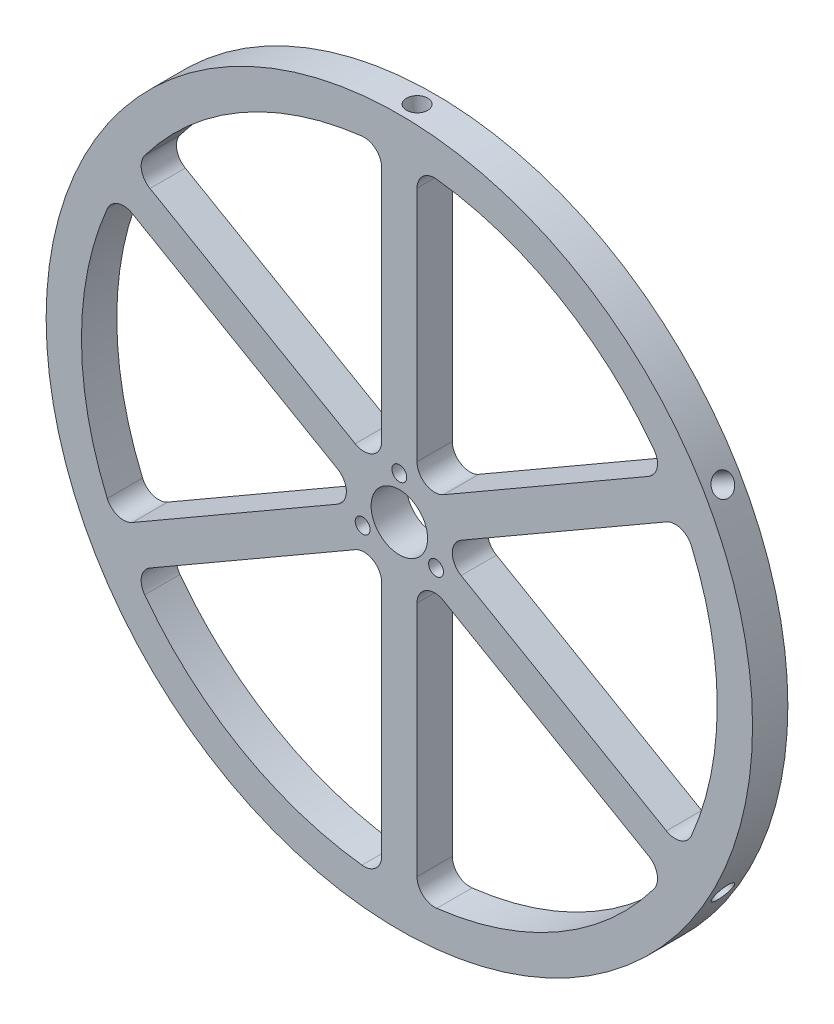
from build123d import *

# Parameters (mm, degrees)
ESQUISSE1_R                  = 100
BOSS_EXTRU_1_DEPTH           = 10
ENL_V_MAT_EXTRU_1_DEPTH      = 142.774468788
ENL_V_MAT_EXTRU_1_DEPTH_BACK = 142.774468788
CONG_1_R                     = 5
ENL_V_MAT_EXTRU_2_DEPTH      = 142.774468788
ENL_V_MAT_EXTRU_2_DEPTH_BACK = 142.774468788
ESQUISSE3_R                  = 8
ENL_V_MAT_EXTRU_3_DEPTH      = 142.774468788
ENL_V_MAT_EXTRU_3_DEPTH_BACK = 142.774468788
ESQUISSE4_R                  = 2.1
ENL_V_START                  = 100
ESQUISSE5_R                  = 3
ENL_V_MAT_EXTRU_4_DEPTH      = 10
R_P_TITION_CIRCULAIRE1_COUNT = 6


with BuildPart() as part:
    # Esquisse1 → Boss.-Extru.1 (new body)
    with BuildSketch(Plane.XY):
        Circle(ESQUISSE1_R)
    extrude(amount=BOSS_EXTRU_1_DEPTH)

    # Esquisse2 → Enlèv. mat.-Extru.1 (cut, two sides: drawn at the far end of the back side and taken through both)
    with BuildSketch(Plane.XY.offset(10).offset(-ENL_V_MAT_EXTRU_1_DEPTH_BACK)):
        with BuildLine():
            Line((10, 0), (80.321912081, 40.60037487))
            ThreePointArc((80.321912081, 40.60037487), (90, 0), (80.321912081, -40.60037487))
            Line((80.321912081, -40.60037487), (10, 0))
        make_face()
        with BuildLine():
            Line((5, -8.660254038), (75.321912081, -49.260628908))
            ThreePointArc((75.321912081, -49.260628908), (45, -77.942286341), (5, -89.861003778))
            Line((5, -89.861003778), (5, -8.660254038))
        make_face()
        with BuildLine():
            Line((-5, -8.660254038), (-5, -89.861003778))
            ThreePointArc((-5, -89.861003778), (-45, -77.942286341), (-75.321912081, -49.260628908))
            Line((-75.321912081, -49.260628908), (-5, -8.660254038))
        make_face()
        with BuildLine():
            Line((-10, 0), (-80.321912081, -40.60037487))
            ThreePointArc((-80.321912081, -40.60037487), (-90, 0), (-80.321912081, 40.60037487))
            Line((-80.321912081, 40.60037487), (-10, 0))
        make_face()
        with BuildLine():
            Line((-5, 8.660254038), (-75.321912081, 49.260628908))
            ThreePointArc((-75.321912081, 49.260628908), (-45, 77.942286341), (-5, 89.861003778))
            Line((-5, 89.861003778), (-5, 8.660254038))
        make_face()
        with BuildLine():
            Line((5, 8.660254038), (5, 89.861003778))
            ThreePointArc((5, 89.861003778), (45, 77.942286341), (75.321912081, 49.260628908))
            Line((75.321912081, 49.260628908), (5, 8.660254038))
        make_face()
    extrude(amount=ENL_V_MAT_EXTRU_1_DEPTH + ENL_V_MAT_EXTRU_1_DEPTH_BACK, mode=Mode.SUBTRACT)

    # Congé1
    cong_1_edges = [part.edges().sort_by_distance(p)[0] for p in [
        (-5, 8.660254038, 5),
        (-10, 0, 5),
        (-5, -8.660254038, 5),
        (5, -8.660254038, 5),
        (10, 0, 5),
        (80.321912081, 40.60037487, 5),
        (80.321912081, -40.60037487, 5),
        (75.321912081, -49.260628908, 5),
        (5, -89.861003778, 5),
        (-5, -89.861003778, 5),
        (-75.321912081, -49.260628908, 5),
        (-80.321912081, -40.60037487, 5),
        (-80.321912081, 40.60037487, 5),
        (-75.321912081, 49.260628908, 5),
        (-5, 89.861003778, 5),
        (5, 89.861003778, 5),
        (75.321912081, 49.260628908, 5),
        (5, 8.660254038, 5),
    ]]
    fillet(cong_1_edges, radius=CONG_1_R)

    # Esquisse3 → Enlèv. mat.-Extru.2 (cut, two sides: drawn at the far end of the back side and taken through both)
    with BuildSketch(Plane.XY.offset(10).offset(-ENL_V_MAT_EXTRU_2_DEPTH_BACK)):
        Circle(ESQUISSE3_R)
    extrude(amount=ENL_V_MAT_EXTRU_2_DEPTH + ENL_V_MAT_EXTRU_2_DEPTH_BACK, mode=Mode.SUBTRACT)

    # Esquisse4 → Enlèv. mat.-Extru.3 (cut, two sides: drawn at the far end of the back side and taken through both)
    with BuildSketch(Plane.XY.offset(10).offset(-ENL_V_MAT_EXTRU_3_DEPTH_BACK)):
        with Locations((0, 12)):
            Circle(ESQUISSE4_R)
        with Locations((10.392304845, -6)):
            Circle(ESQUISSE4_R)
        with Locations((-10.392304845, -6)):
            Circle(ESQUISSE4_R)
    extrude(amount=ENL_V_MAT_EXTRU_3_DEPTH + ENL_V_MAT_EXTRU_3_DEPTH_BACK, mode=Mode.SUBTRACT)

    # Esquisse5 → Enlèv. mat.-Extru.4 (cut)
    with BuildSketch(Plane(origin=(0, 0, 0), x_dir=(0, 0, -1), z_dir=(0, 1, 0)).offset(ENL_V_START)):
        with Locations((-5, 0)):
            Circle(ESQUISSE5_R)
    enl_v_mat_extru_4 = extrude(amount=-ENL_V_MAT_EXTRU_4_DEPTH, mode=Mode.SUBTRACT)

    # Répétition circulaire1: Enlèv. mat.-Extru.4 ×6 about axis
    r_p_tition_circulaire1_axis = Axis((0, 0, 10), (0, 0, 1))
    for i in range(1, R_P_TITION_CIRCULAIRE1_COUNT):
        add(enl_v_mat_extru_4.rotate(r_p_tition_circulaire1_axis, i * 360 / R_P_TITION_CIRCULAIRE1_COUNT), mode=Mode.SUBTRACT)


solid = part.part
